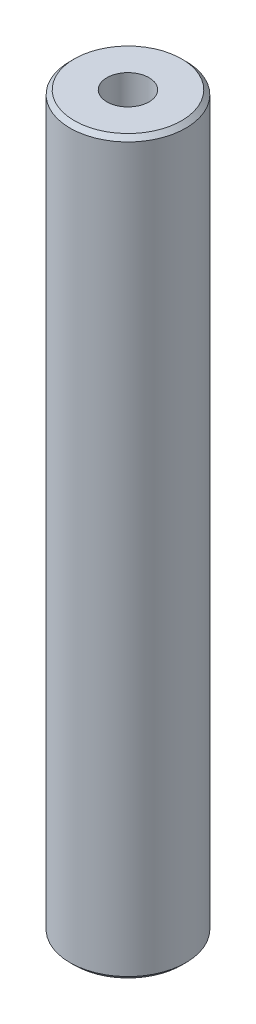
from build123d import *

# Parameters (mm, degrees)
SKETCH1_R           = 47.5
BOSS_EXTRUDE1_DEPTH = 600
SKETCH2_R           = 17.26211347
CUT_EXTRUDE1_DEPTH  = 604.748706003
CHAMFER1_SIZE       = 3.512049941


with BuildPart() as part:
    # Sketch1 → Boss-Extrude1 (new body)
    with BuildSketch(Plane(origin=(0, 0, 0), x_dir=(1, 0, 0), z_dir=(0, 1, 0))):
        Circle(SKETCH1_R)
    extrude(amount=BOSS_EXTRUDE1_DEPTH)

    # Sketch2 → Cut-Extrude1 (cut, through all)
    with BuildSketch(Plane(origin=(0, 0, 0), x_dir=(1, 0, 0), z_dir=(0, 1, 0))):
        Circle(SKETCH2_R)
    extrude(amount=CUT_EXTRUDE1_DEPTH, mode=Mode.SUBTRACT)

    # Chamfer1
    chamfer1_edges = [part.edges().sort_by_distance(p)[0] for p in [
        (-47.5, 600, 0),
        (-47.5, 0, 0),
    ]]
    chamfer(chamfer1_edges, length=CHAMFER1_SIZE)


solid = part.part
